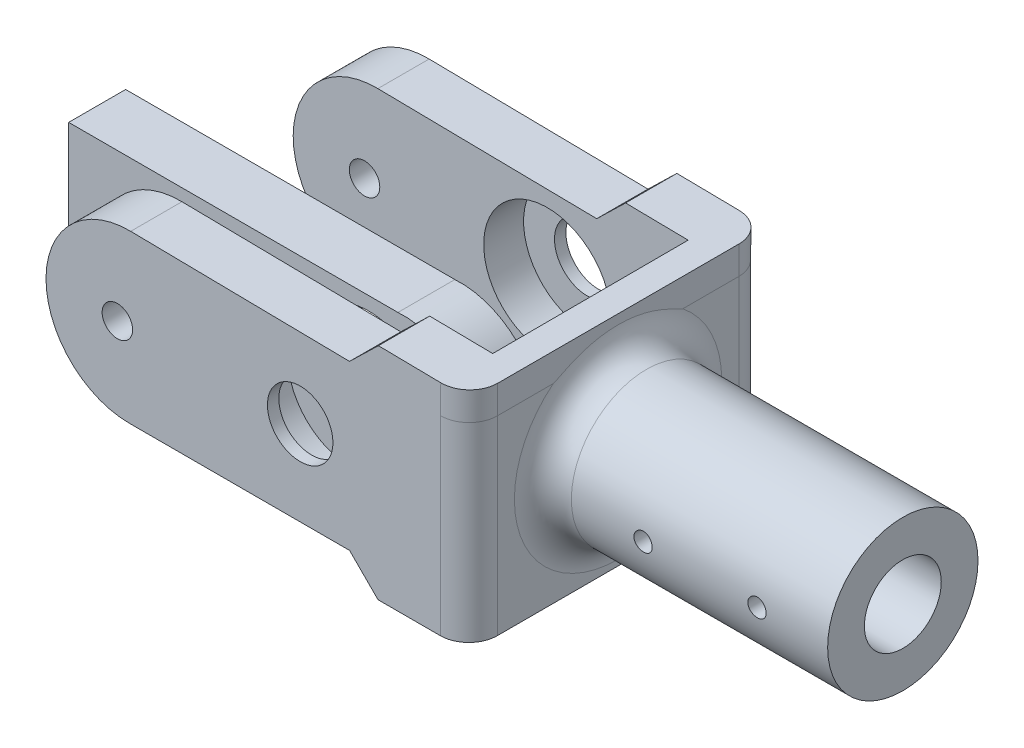
from build123d import *

# Parameters (mm, degrees)
SKETCH2_R               = 2.675
SKETCH2_R_2             = 11.175
BOSS_EXTRUDE1_DEPTH     = 10
SKETCH3_R               = 2.675
BOSS_EXTRUDE2_DEPTH     = 9
SKETCH4_W               = 4.870131923
SKETCH4_H               = 40.4
BOSS_EXTRUDE3_DEPTH     = 28.433015
BOSS_EXTRUDE6_START     = -34.4
SKETCH5_R               = 2.675
BOSS_EXTRUDE6_DEPTH     = 9
BOSS_EXTRUDE8_DEPTH     = 5
BOSS_EXTRUDE14_DEPTH    = 5
CUT_EXTRUDE4_START      = 2
SKETCH6_R               = 11.175
CUT_EXTRUDE4_DEPTH      = 7
CUT_EXTRUDE5_START      = 9
SKETCH9_R               = 11.175
CUT_EXTRUDE5_DEPTH      = 7
CUT_EXTRUDE6_DEPTH      = 104.158354079
CUT_EXTRUDE6_DEPTH_BACK = 104.158354079
SKETCH10_R              = 5.75
SKETCH11_R              = 13.2
SKETCH11_R_2            = 6.75
BOSS_EXTRUDE10_DEPTH    = 50
CHAMFER2_SIZE           = 10
FILLET6_START           = -33.433014888
FILLET6_DEPTH           = 33.433014888
FILLET6_START_2         = -34
FILLET6_2_DEPTH         = 34.033994958
FILLET6_START_3         = 1.17761157
FILLET6_3_DEPTH         = 5.82238843
CUT_EXTRUDE8_DEPTH      = 147.133487621
CUT_EXTRUDE8_DEPTH_BACK = 147.133487621
SKETCH17_R              = 1.6


with BuildPart() as part:
    # Sketch2 → Boss-Extrude1 (new body)
    with BuildSketch(Plane.XY):
        with BuildLine():
            Line((32.056676219, -28.433014888), (59.748433285, -28.433014888))
            ThreePointArc((59.748433285, -28.433014888), (72.993636608, -13.245203322), (57.805825042, 0))
            Line((57.805825042, 0), (0, 0))
            Line((0, 0), (0, -28.433014888))
            Line((0, -28.433014888), (32.056676219, -28.433014888))
        make_face()
        with Locations((20.546118489, -13.943106494)):
            Circle(SKETCH2_R, mode=Mode.SUBTRACT)
        with Locations((52.64391887, -13.515990827)):
            Circle(SKETCH2_R_2, mode=Mode.SUBTRACT)
    extrude(amount=-BOSS_EXTRUDE1_DEPTH)


with BuildPart() as body_2:
    # Sketch3 → Boss-Extrude2 (new body)
    with BuildSketch(Plane.XY.offset(3)):
        with BuildLine():
            Line((82.255320155, -28.433014888), (82.255320155, -0.003014888))
            Line((82.255320155, -0.003014888), (26.316883723, 0.825139649))
            Line((26.316883723, 0.825139649), (22.888242003, 0.875899831))
            ThreePointArc((22.888242003, 0.875899831), (8.016439514, -13.66927981), (22.67129832, -28.433014888))
            Line((22.67129832, -28.433014888), (26.316883723, -28.433014888))
            Line((26.316883723, -28.433014888), (82.255320155, -28.433014888))
        make_face()
        with Locations((20.546118489, -13.943106494)):
            Circle(SKETCH3_R, mode=Mode.SUBTRACT)
    extrude(amount=BOSS_EXTRUDE2_DEPTH)

    # Sketch4 → Boss-Extrude3 (add)
    with BuildSketch(Plane(origin=(0, 0, 0), x_dir=(1, 0, 0), z_dir=(0, 1, 0))):
        with Locations((79.820254194, 17.2)):
            Rectangle(SKETCH4_W, SKETCH4_H)
    extrude(amount=-BOSS_EXTRUDE3_DEPTH)

    # Sketch5 → Boss-Extrude6 (add)
    with BuildSketch(Plane.XY.offset(3).offset(BOSS_EXTRUDE6_START)):
        with BuildLine():
            Line((82.255320155, -28.433014888), (82.255320155, -0.003014888))
            Line((82.255320155, -0.003014888), (22.888242003, 0.875899831))
            ThreePointArc((22.888242003, 0.875899831), (8.016439514, -13.66927981), (22.67129832, -28.433014888))
            Line((22.67129832, -28.433014888), (82.255320155, -28.433014888))
        make_face()
        with Locations((20.546118489, -13.943106494)):
            Circle(SKETCH5_R, mode=Mode.SUBTRACT)
    extrude(amount=-BOSS_EXTRUDE6_DEPTH)

    # Sketch14 → Boss-Extrude8 (add)
    with BuildSketch(Plane(origin=(0.017980195, 1.214488327, 0), x_dir=(0.9998904277083674, -0.014803127276965826, 0), z_dir=(0.014803127276965828, 0.9998904277083676, 0))):
        Polygon((56.298347251, 40.4), (82.24635188, 40.4), (82.24635188, -12), (56.298347251, -12), (56.298347251, -3), (77.36544625, -3), (77.278840937, 31.4), (56.298347251, 31.4), align=None)
    extrude(amount=BOSS_EXTRUDE8_DEPTH)

    # Sketch16 → Boss-Extrude14 (add)
    with BuildSketch(Plane.XZ.offset(28.433014888)):
        Polygon((77.385188232, 3), (56.315188232, 3), (56.315188232, 12), (82.255320155, 12), (82.255320155, -40.4), (56.315188232, -40.4), (56.315188232, -31.4), (77.385188232, -31.4), align=None)
    extrude(amount=BOSS_EXTRUDE14_DEPTH)

    # Sketch6 → Cut-Extrude4 (cut)
    with BuildSketch(Plane(origin=(0, 0, 12), x_dir=(-1, 0, 0), z_dir=(0, 0, -1)).offset(CUT_EXTRUDE4_START)):
        with Locations(Location((-52.64391887, -13.515990827, 0), (0, 0, 180))):
            Circle(SKETCH6_R)
    extrude(amount=CUT_EXTRUDE4_DEPTH, mode=Mode.SUBTRACT)

    # Sketch9 → Cut-Extrude5 (cut)
    with BuildSketch(Plane.XY.offset(-40.4).offset(CUT_EXTRUDE5_START)):
        with Locations((52.64391887, -13.515990827)):
            Circle(SKETCH9_R)
    extrude(amount=-CUT_EXTRUDE5_DEPTH, mode=Mode.SUBTRACT)

    # Sketch10 → Cut-Extrude6 (cut, two sides: drawn at the far end of the back side and taken through both)
    with BuildSketch(Plane.XY.offset(12).offset(-CUT_EXTRUDE6_DEPTH_BACK)):
        with Locations((52.64391887, -13.515990827)):
            Circle(SKETCH10_R)
    extrude(amount=CUT_EXTRUDE6_DEPTH + CUT_EXTRUDE6_DEPTH_BACK, mode=Mode.SUBTRACT)

    # Sketch11 → Boss-Extrude10 (add)
    with BuildSketch(Plane(origin=(82.255320155, 0, 0), x_dir=(0, 0, -1), z_dir=(1, 0, 0))):
        with Locations(Location((14.2, -14.218014888, 0), (0, 0, 180))):
            Circle(SKETCH11_R)
        with Locations((14.2, -14.218014888)):
            Circle(SKETCH11_R_2, mode=Mode.SUBTRACT)
    extrude(amount=BOSS_EXTRUDE10_DEPTH)

    # Fillet5: read off the stored shape, not the designer's step
    # Fillet5 outline → Fillet5 (revolve)
    with BuildSketch(Plane(origin=(0, -14.218014888, -14.2), x_dir=(0, 1, 0), z_dir=(0, 0, -1))):
        with BuildLine():
            Line((13.2, 82.255320155), (18.2, 82.255320155))
            ThreePointArc((18.2, 82.255320155), (14.664466094, 83.719786249), (13.2, 87.255320155))
            Line((13.2, 87.255320155), (13.2, 82.255320155))
        make_face()
    revolve(axis=Axis((0, -14.218014888, -14.2), (1, 0, 0)))

    # Chamfer2
    # the kernel refuses this chamfer: 10 mm, written as the material it takes off along each edge
    with BuildSketch(Plane(origin=(56.315188232, -33.433014888, -66.11682988), x_dir=(1, 0, 0), z_dir=(0, 0, 1))) as chamfer2_piece_1_section:
        Polygon((CHAMFER2_SIZE, 0), (0, CHAMFER2_SIZE), (0, 0), align=None)
    chamfer2_piece_1 = extrude(amount=60.433659759, mode=Mode.PRIVATE)
    chamfer2_piece_1 = split(chamfer2_piece_1, bisect_by=Plane(origin=(56.315188232, -28.433015, -66.11682988), z_dir=(0, -1, 0)), keep=Keep.TOP, mode=Mode.PRIVATE)
    add(chamfer2_piece_1, mode=Mode.SUBTRACT)
    with BuildSketch(Plane(origin=(56.315188232, -33.433014888, -22.71682988), x_dir=(1, 0, 0), z_dir=(0, 0, 1))) as chamfer2_piece_2_section:
        Polygon((CHAMFER2_SIZE, 0), (0, CHAMFER2_SIZE), (0, 0), align=None)
    chamfer2_piece_2 = extrude(amount=60.433659759, mode=Mode.PRIVATE)
    chamfer2_piece_2 = split(chamfer2_piece_2, bisect_by=Plane(origin=(56.315188232, -28.433014888, -22.71682988), z_dir=(0, -1, 0)), keep=Keep.TOP, mode=Mode.PRIVATE)
    add(chamfer2_piece_2, mode=Mode.SUBTRACT)
    with BuildSketch(Plane(origin=(56.384174343, 5.380548866, 37.71682988), x_dir=(0.9998904277083674, -0.0148031272769658, 0), z_dir=(0, 0, -1))) as chamfer2_piece_3_section:
        Polygon((CHAMFER2_SIZE, 0), (0, CHAMFER2_SIZE), (0, 0), align=None)
    chamfer2_piece_3 = extrude(amount=60.433659759, mode=Mode.PRIVATE)
    chamfer2_piece_3 = split(chamfer2_piece_3, bisect_by=Plane(origin=(56.310158707, 0.381096728, 37.71682988), z_dir=(0.014803127276964706, 0.9998904277083674, 0)), keep=Keep.TOP, mode=Mode.PRIVATE)
    add(chamfer2_piece_3, mode=Mode.SUBTRACT)
    with BuildSketch(Plane(origin=(56.384174343, 5.380548866, -5.68317012), x_dir=(0.9998904277083674, -0.0148031272769658, 0), z_dir=(0, 0, -1))) as chamfer2_piece_4_section:
        Polygon((CHAMFER2_SIZE, 0), (0, CHAMFER2_SIZE), (0, 0), align=None)
    chamfer2_piece_4 = extrude(amount=60.433659759, mode=Mode.PRIVATE)
    chamfer2_piece_4 = split(chamfer2_piece_4, bisect_by=Plane(origin=(56.310158707, 0.381096728, -5.68317012), z_dir=(0.01480312727696477, 0.9998904277083674, 0)), keep=Keep.TOP, mode=Mode.PRIVATE)
    add(chamfer2_piece_4, mode=Mode.SUBTRACT)

    # Fillet6: read off the stored shape, not the designer's step
    # Fillet6 outline → Fillet6 (add)
    with BuildSketch(Plane(origin=(0, 0, 0), x_dir=(1, 0, 0), z_dir=(0, 1, 0)).offset(FILLET6_START)):
        with BuildLine():
            Line((77.385188232, 31.4), (72.385188232, 31.4))
            ThreePointArc((72.385188232, 31.4), (75.920722138, 29.935533906), (77.385188232, 26.4))
            Line((77.385188232, 26.4), (77.385188232, 31.4))
        make_face()
        with BuildLine():
            Line((77.385188232, -3), (77.385188232, 2))
            ThreePointArc((77.385188232, 2), (75.920722138, -1.535533906), (72.385188232, -3))
            Line((72.385188232, -3), (77.385188232, -3))
        make_face()
    extrude(amount=FILLET6_DEPTH)

    # Fillet6 2 outline → Fillet6 2 (cut)
    with BuildSketch(Plane(origin=(0, 0, 0), x_dir=(1, 0, 0), z_dir=(0, 1, 0)).offset(FILLET6_START_2)):
        with BuildLine():
            Line((82.255320155, -12), (82.255320155, -7))
            ThreePointArc((82.255320155, -7), (80.790854061, -10.535533905), (77.255320155, -12))
            Line((77.255320155, -12), (82.255320155, -12))
        make_face()
        with BuildLine():
            ThreePointArc((77.255320155, 40.4), (80.790854061, 38.935533905), (82.255320155, 35.4))
            Line((82.255320155, 35.4), (82.255320155, 40.4))
            Line((82.255320155, 40.4), (77.255320155, 40.4))
        make_face()
    extrude(amount=FILLET6_2_DEPTH, mode=Mode.SUBTRACT)

    # Fillet6 3 outline → Fillet6 3 (cut)
    with BuildSketch(Plane(origin=(0, 0, 0), x_dir=(0.9998904277083673, -0.014803127276965807, 0), z_dir=(0.014803127276965807, 0.9998904277083674, 0)).offset(FILLET6_START_3)):
        with BuildLine():
            ThreePointArc((77.24635188, 40.4), (80.781885786, 38.935533906), (82.24635188, 35.4))
            Line((82.24635188, 35.4), (82.24635188, 40.4))
            Line((82.24635188, 40.4), (77.24635188, 40.4))
        make_face()
        with BuildLine():
            ThreePointArc((82.24635188, -7), (80.781885786, -10.535533906), (77.24635188, -12))
            Line((77.24635188, -12), (82.24635188, -12))
            Line((82.24635188, -12), (82.24635188, -7))
        make_face()
    extrude(amount=FILLET6_3_DEPTH, mode=Mode.SUBTRACT)

    # Sketch17 → Cut-Extrude8 (cut, two sides: drawn at the far end of the back side and taken through both)
    with BuildSketch(Plane(origin=(0, 0, -40.4), x_dir=(-1, 0, 0), z_dir=(0, 0, -1)).offset(-CUT_EXTRUDE8_DEPTH_BACK)):
        with Locations((-119.842122159, -14.394171675)):
            Circle(SKETCH17_R)
        with Locations((-99.842122159, -14.394171675)):
            Circle(SKETCH17_R)
    extrude(amount=CUT_EXTRUDE8_DEPTH + CUT_EXTRUDE8_DEPTH_BACK, mode=Mode.SUBTRACT)


solid = Compound([part.part, body_2.part])
